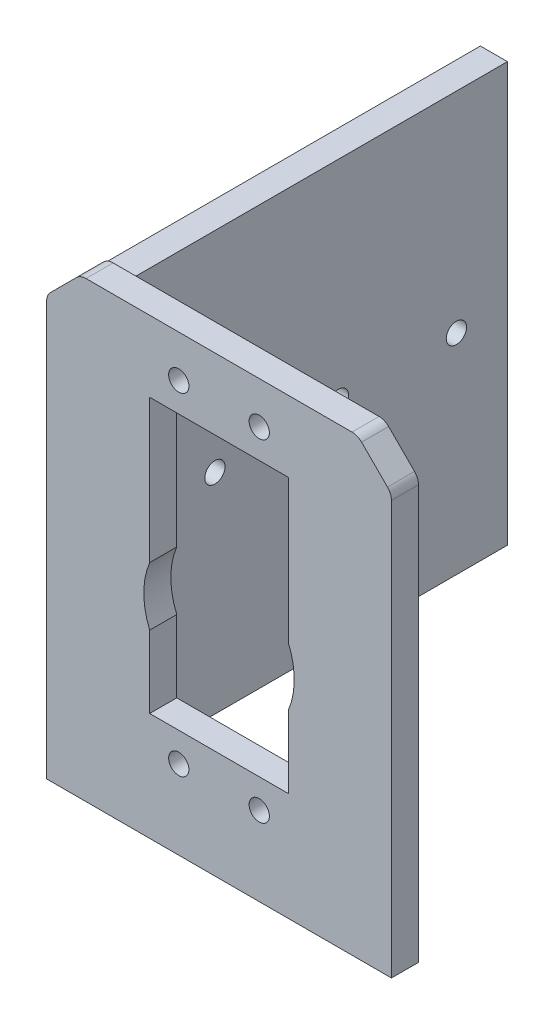
from build123d import *

# Parameters (mm, degrees)
SKETCH1_R           = 1.5
BOSS_EXTRUDE3_DEPTH = 4
SKETCH2_W           = 4
SKETCH2_H           = 61.93693974
BOSS_EXTRUDE4_DEPTH = 60
SKETCH3_R           = 1.5
CUT_EXTRUDE1_DEPTH  = 10


with BuildPart() as part:
    # Sketch1 → Boss-Extrude3 (new body)
    with BuildSketch(Plane.XY):
        with BuildLine():
            Line((0, 61.171572875), (0, 0))
            Line((0, 0), (51, 0))
            Line((51, 0), (51, 61.171572875))
            ThreePointArc((51, 61.171572875), (50.847759065, 61.93693974), (50.414213562, 62.585786438))
            Line((50.414213562, 62.585786438), (46.585786438, 66.414213562))
            ThreePointArc((46.585786438, 66.414213562), (45.93693974, 66.847759065), (45.171572875, 67))
            Line((45.171572875, 67), (5.828427125, 67))
            ThreePointArc((5.828427125, 67), (5.06306026, 66.847759065), (4.414213562, 66.414213562))
            Line((4.414213562, 66.414213562), (0.585786438, 62.585786438))
            ThreePointArc((0.585786438, 62.585786438), (0.152240935, 61.93693974), (0, 61.171572875))
        make_face()
        with Locations((19.55, 11.7)):
            Circle(SKETCH1_R, mode=Mode.SUBTRACT)
        with Locations((31.45, 11.7)):
            Circle(SKETCH1_R, mode=Mode.SUBTRACT)
        with Locations((31.45, 60.8)):
            Circle(SKETCH1_R, mode=Mode.SUBTRACT)
        with Locations((19.55, 60.8)):
            Circle(SKETCH1_R, mode=Mode.SUBTRACT)
        with BuildLine():
            Line((15.25, 56.5), (35.75, 56.5))
            Line((35.75, 56.5), (35.75, 35.324710973))
            ThreePointArc((35.75, 35.324710973), (36.625, 31), (35.75, 26.675289027))
            Line((35.75, 26.675289027), (35.75, 16))
            Line((35.75, 16), (15.25, 16))
            Line((15.25, 16), (15.25, 26.675289027))
            ThreePointArc((15.25, 26.675289027), (14.375, 31), (15.25, 35.324710973))
            Line((15.25, 35.324710973), (15.25, 56.5))
        make_face(mode=Mode.SUBTRACT)
    extrude(amount=BOSS_EXTRUDE3_DEPTH)

    # Sketch2 → Boss-Extrude4 (add)
    with BuildSketch(Plane(origin=(0, 0, 0), x_dir=(-1, 0, 0), z_dir=(0, 0, -1))):
        with Locations((-2.152240935, 30.96846987)):
            Rectangle(SKETCH2_W, SKETCH2_H)
    extrude(amount=BOSS_EXTRUDE4_DEPTH)

    # Sketch3 → Cut-Extrude1 (cut)
    with BuildSketch(Plane.ZY.offset(-0.152240935)):
        with Locations((-52.452622695, 30.96846987)):
            Circle(SKETCH3_R)
        with Locations((-35.004105101, 30.96846987)):
            Circle(SKETCH3_R)
        with Locations((-16.741926064, 30.96846987)):
            Circle(SKETCH3_R)
    extrude(amount=-CUT_EXTRUDE1_DEPTH, mode=Mode.SUBTRACT)


solid = part.part
